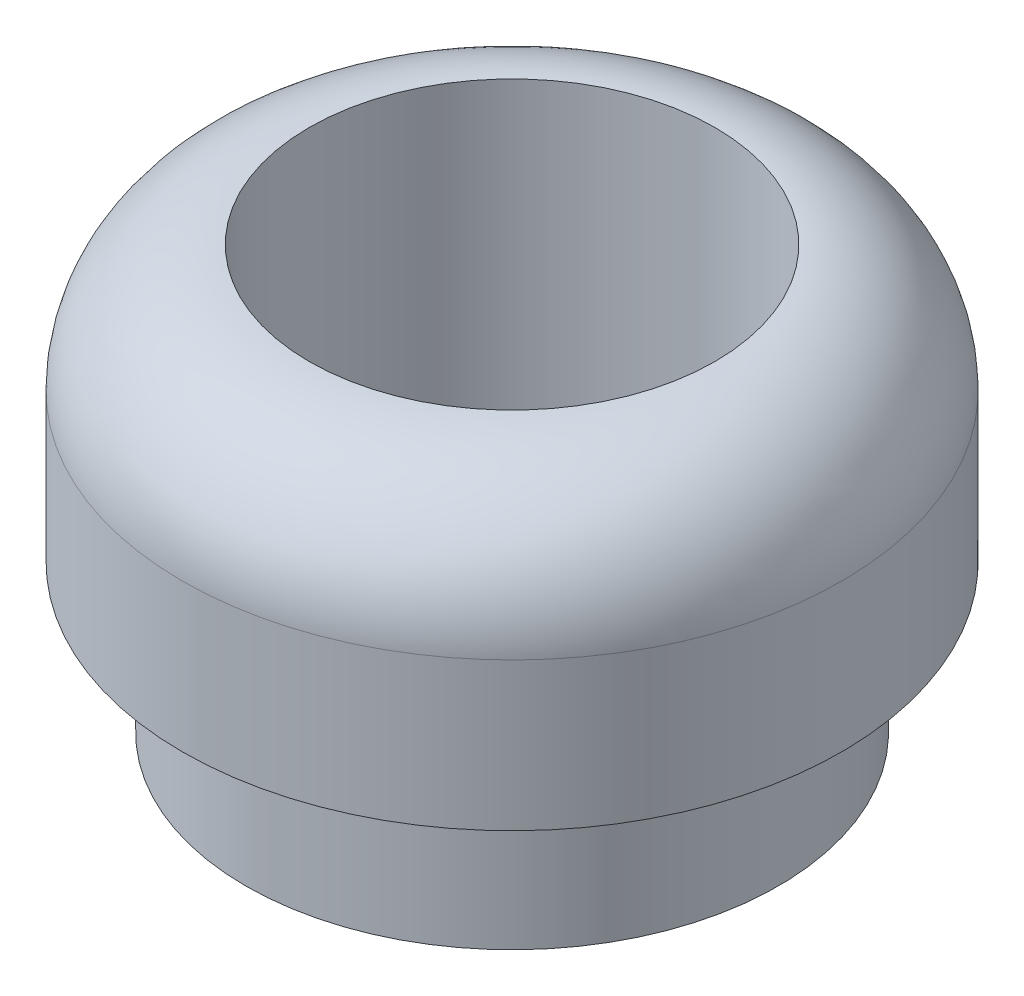
from build123d import *

# Parameters (mm, degrees)
SKETCH1_R               = 7.8
BOSS_EXTRUDE1_DEPTH     = 10
SKETCH2_R               = 4.8
CUT_EXTRUDE1_DEPTH      = 8
CUT_EXTRUDE2_DEPTH      = 1.5
CUT_EXTRUDE2_DEPTH_BACK = 14.626444878
SKETCH3_R               = 7.8
SKETCH3_R_2             = 6.3
SKETCH3_R_3             = 2.8
FILLET1_R               = 3


with BuildPart() as part:
    # Sketch1 → Boss-Extrude1 (new body)
    with BuildSketch(Plane(origin=(0, 0, 0), x_dir=(1, 0, 0), z_dir=(0, 1, 0))):
        with Locations(Location((0, 0, 0), (0, 0, 270))):
            Circle(SKETCH1_R)
    extrude(amount=BOSS_EXTRUDE1_DEPTH)

    # Sketch2 → Cut-Extrude1 (cut)
    with BuildSketch(Plane(origin=(0, 10, 0), x_dir=(1, 0, 0), z_dir=(0, 1, 0))):
        with Locations(Location((0, 0, 0), (0, 0, 270))):
            Circle(SKETCH2_R)
    extrude(amount=-CUT_EXTRUDE1_DEPTH, mode=Mode.SUBTRACT)

    # Sketch3 → Cut-Extrude2 (cut, two sides: drawn at the far end of the back side and taken through both)
    # profile 1 of 2: a face of its own
    with BuildSketch(Plane(origin=(0, 2, 0), x_dir=(1, 0, 0), z_dir=(0, 1, 0)).offset(-CUT_EXTRUDE2_DEPTH_BACK)):
        with Locations(Location((0, 0, 0), (0, 0, 270))):
            Circle(SKETCH3_R)
        with Locations(Location((0, 0, 0), (0, 0, 270))):
            Circle(SKETCH3_R_2, mode=Mode.SUBTRACT)
    # profile 2 of 2: a face of its own
    with BuildSketch(Plane(origin=(0, 2, 0), x_dir=(1, 0, 0), z_dir=(0, 1, 0)).offset(-CUT_EXTRUDE2_DEPTH_BACK)):
        with Locations(Location((0, 0, 0), (0, 0, 270))):
            Circle(SKETCH3_R_3)
    extrude(amount=CUT_EXTRUDE2_DEPTH + CUT_EXTRUDE2_DEPTH_BACK, mode=Mode.SUBTRACT)

    # Fillet1
    fillet1_edges = [part.edges().sort_by_distance(p)[0] for p in [
        (0, 10, -7.8),
    ]]
    fillet(fillet1_edges, radius=FILLET1_R - 0.0001)  # a hair under: the kernel refuses the full size


solid = part.part
